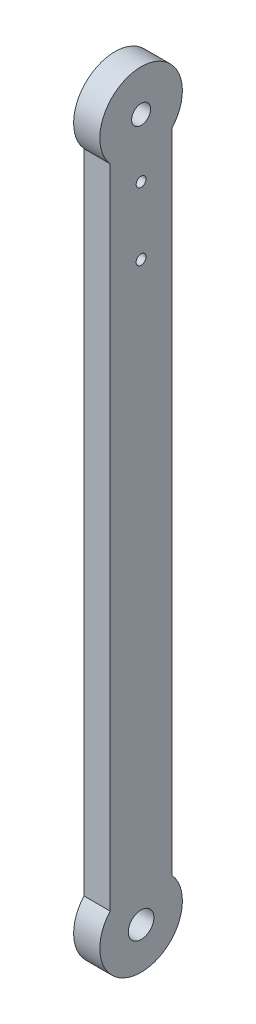
from build123d import *

# Parameters (mm, degrees)
SKETCH1_R           = 1.55
SKETCH1_R_2         = 0.6
SKETCH1_R_3         = 1.15
BOSS_EXTRUDE3_DEPTH = 3.175


with BuildPart() as part:
    # Sketch1 → Boss-Extrude3 (new body)
    with BuildSketch(Plane(origin=(0, 0, 0), x_dir=(0, 0, -1), z_dir=(1, 0, 0))):
        with BuildLine():
            Line((3.75, -3.307189139), (3.75, -81.692810861))
            ThreePointArc((3.75, -81.692810861), (0, -90), (-3.75, -81.692810861))
            Line((-3.75, -81.692810861), (-3.75, -3.307189139))
            ThreePointArc((-3.75, -3.307189139), (0, 5), (3.75, -3.307189139))
        make_face()
        with Locations((0, -85)):
            Circle(SKETCH1_R, mode=Mode.SUBTRACT)
        with Locations((0, -15.22)):
            Circle(SKETCH1_R_2, mode=Mode.SUBTRACT)
        Circle(SKETCH1_R_3, mode=Mode.SUBTRACT)
        with Locations((0, -7.07)):
            Circle(SKETCH1_R_2, mode=Mode.SUBTRACT)
    extrude(amount=BOSS_EXTRUDE3_DEPTH)


solid = part.part
